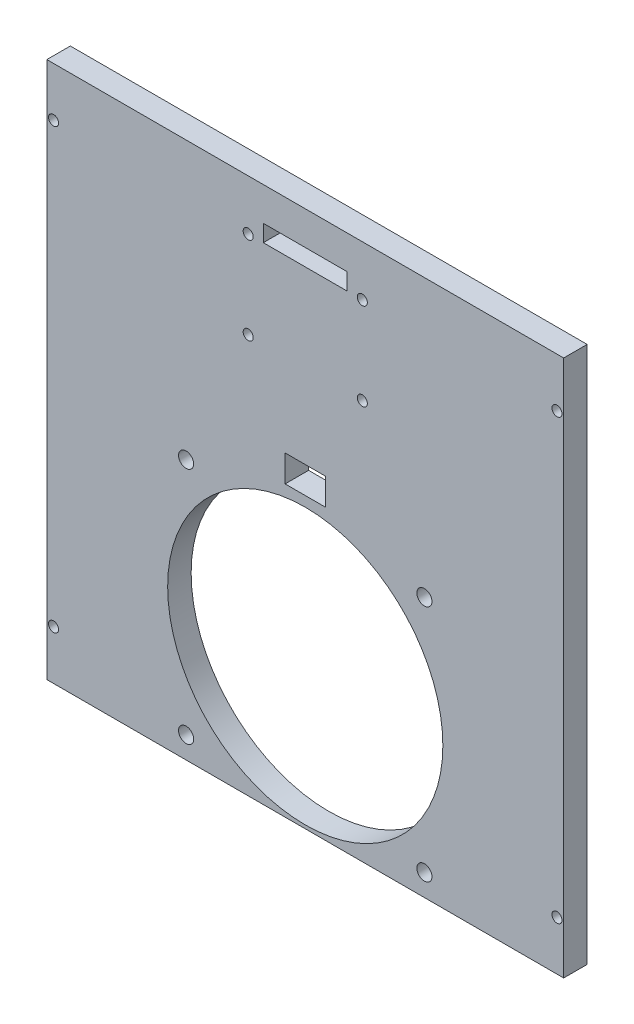
from build123d import *

# Parameters (mm, degrees)
SCHIZZO1_W                   = 154
SCHIZZO1_H                   = 160
SCHIZZO1_R                   = 1.5
ESTRUSIONE_ESTRUSIONE1_DEPTH = 7
SCHIZZO2_R                   = 41
SCHIZZO2_R_2                 = 2.25
SCHIZZO2_W                   = 12
SCHIZZO2_H                   = 8
TAGLIO_ESTRUSIONE1_DEPTH     = 10
SCHIZZO3_R                   = 1.5
SCHIZZO3_W                   = 25
SCHIZZO3_H                   = 5
TAGLIO_ESTRUSIONE2_DEPTH     = 10
SCHIZZO4_R                   = 3
SCHIZZO4_R_2                 = 1.5
ESTRUSIONE_ESTRUSIONE2_DEPTH = 4.5
RACCORDO1_R                  = 2


with BuildPart() as part:
    # Schizzo1 → Estrusione-Estrusione1 (new body)
    with BuildSketch(Plane.XY):
        Rectangle(SCHIZZO1_W, SCHIZZO1_H)
        with Locations((-75, 65.34394728)):
            Circle(SCHIZZO1_R, mode=Mode.SUBTRACT)
        with Locations((75, 65.34394728)):
            Circle(SCHIZZO1_R, mode=Mode.SUBTRACT)
        with Locations((75, -65.34394728)):
            Circle(SCHIZZO1_R, mode=Mode.SUBTRACT)
        with Locations((-75, -65.34394728)):
            Circle(SCHIZZO1_R, mode=Mode.SUBTRACT)
    extrude(amount=ESTRUSIONE_ESTRUSIONE1_DEPTH)

    # Schizzo2 → Taglio-Estrusione1 (cut)
    with BuildSketch(Plane(origin=(0, 0, 0), x_dir=(-1, 0, 0), z_dir=(0, 0, -1))):
        with Locations((0, -38)):
            Circle(SCHIZZO2_R)
        with Locations((35.499999997, -2.500000003)):
            Circle(SCHIZZO2_R_2)
        with Locations((35.499999997, -73.499999997)):
            Circle(SCHIZZO2_R_2)
        with Locations((-35.499999997, -2.500000003)):
            Circle(SCHIZZO2_R_2)
        with Locations((-35.499999997, -73.499999997)):
            Circle(SCHIZZO2_R_2)
        with Locations((0, 10)):
            Rectangle(SCHIZZO2_W, SCHIZZO2_H)
    extrude(amount=-TAGLIO_ESTRUSIONE1_DEPTH, mode=Mode.SUBTRACT)

    # Schizzo3 → Taglio-Estrusione2 (cut)
    with BuildSketch(Plane(origin=(0, 0, 0), x_dir=(-1, 0, 0), z_dir=(0, 0, -1))):
        with Locations((17, 65)):
            Circle(SCHIZZO3_R)
        with Locations((17, 39)):
            Circle(SCHIZZO3_R)
        with Locations((-17, 39)):
            Circle(SCHIZZO3_R)
        with Locations((-17, 65)):
            Circle(SCHIZZO3_R)
        with Locations((0, 67.5)):
            Rectangle(SCHIZZO3_W, SCHIZZO3_H)
    extrude(amount=-TAGLIO_ESTRUSIONE2_DEPTH, mode=Mode.SUBTRACT)

    # Schizzo4 → Estrusione-Estrusione2 (add)
    # profile 1 of 2: a face of its own
    with BuildSketch(Plane(origin=(0, 0, 0), x_dir=(-1, 0, 0), z_dir=(0, 0, -1))):
        with Locations((8, 37)):
            Circle(SCHIZZO4_R)
        with Locations((8, 37)):
            Circle(SCHIZZO4_R_2, mode=Mode.SUBTRACT)
    # profile 2 of 2: a face of its own
    with BuildSketch(Plane(origin=(0, 0, 0), x_dir=(-1, 0, 0), z_dir=(0, 0, -1))):
        with Locations((-8, 37)):
            Circle(SCHIZZO4_R)
        with Locations((-8, 37)):
            Circle(SCHIZZO4_R_2, mode=Mode.SUBTRACT)
    extrude(amount=ESTRUSIONE_ESTRUSIONE2_DEPTH)

    # Raccordo1
    raccordo1_edges = [part.edges().sort_by_distance(p)[0] for p in [
        (11, 37, 0),
        (-5, 37, 0),
    ]]
    fillet(raccordo1_edges, radius=RACCORDO1_R)


solid = part.part
